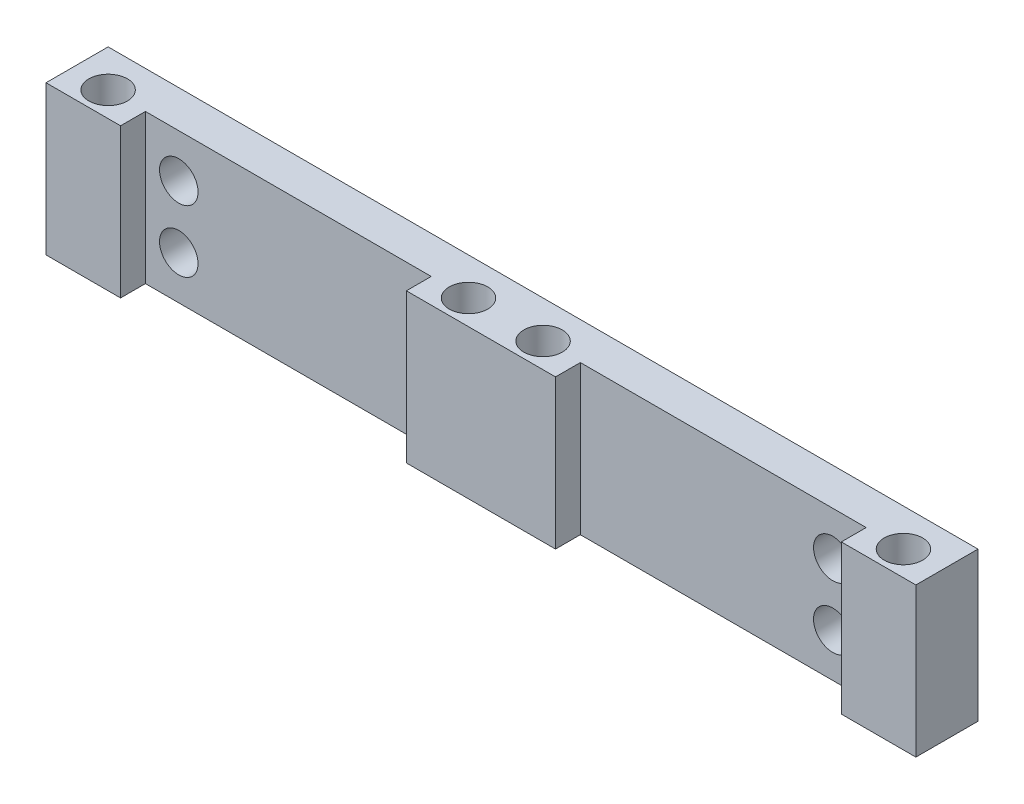
from build123d import *

# Parameters (mm, degrees)
SKETCH_1_W                = 100
SKETCH_1_H                = 12
SKETCH_1_R                = 1.75
EXTRUDE_1_DEPTH           = 5
EXTRUDE_2_DEPTH           = 3
EXTRUDE_5_DEPTH           = 35
CUT_EXTRUDE_START         = -7
CUT_EXTRUDE_3_OUTLINE_R   = 1.75
CUT_EXTRUDE_3_DEPTH       = 14
SKETCH_19_W               = 65
SKETCH_19_H               = 12
CUT_EXTRUDE_7_DEPTH       = 10
CUT_EXTRUDE_8_DEPTH       = 10
SKETCH_21_R               = 1.75
CUT_EXTRUDE_9_DEPTH       = 25
FILLET_3_R                = 2
FILLET_4_R                = 1
FILLET_5_R                = 5
CUT_EXTRUDE_10_DEPTH      = 10
CUT_EXTRUDE_10_DEPTH_BACK = 20
SKETCH_22_W               = 69.035693394
SKETCH_22_H               = 99.85453556
SKETCH_24_W               = 23
SKETCH_24_H               = 12
CUT_EXTRUDE_11_DEPTH      = 2
SKETCH_25_R               = 1.55
CUT_EXTRUDE_12_DEPTH      = 17
SKETCH_27_R               = 1.75
EXTRUDE_7_DEPTH           = 3
SKETCH_28_R               = 1.55
CUT_EXTRUDE_13_DEPTH      = 11


# Read off the part's stored shape, not the designer's step: 切除-拉伸3
with BuildPart() as part:
    # 草图1 → 凸台-拉伸1 (new body)
    with BuildSketch(Plane.XY):
        Rectangle(SKETCH_1_W, SKETCH_1_H)
        with Locations((-26.315, 2.5)):
            Circle(SKETCH_1_R, mode=Mode.SUBTRACT)
        with Locations((-26.315, -2.5)):
            Circle(SKETCH_1_R, mode=Mode.SUBTRACT)
        with Locations((26.315, -2.5)):
            Circle(SKETCH_1_R, mode=Mode.SUBTRACT)
        with Locations((26.315, 2.5)):
            Circle(SKETCH_1_R, mode=Mode.SUBTRACT)
    extrude(amount=-EXTRUDE_1_DEPTH)

    # 草图2 → 凸台-拉伸2 (add)
    with BuildSketch(Plane(origin=(15, 0, 0), x_dir=(0, 0, -1), z_dir=(1, 0, 0))):
        Polygon((0, 6), (-92, 7), (-92, -7), (0, -6), align=None)
    extrude(amount=EXTRUDE_2_DEPTH)

    # 草图10 → 凸台-拉伸5 (add)
    with BuildSketch(Plane(origin=(18, 0, 0), x_dir=(0, 0, -1), z_dir=(1, 0, 0))):
        Polygon((-92, -3.999822784), (-92, -7), (0, -6), (0, -2.999822784), align=None)
        Polygon((-92, 7), (-92, 3.999822784), (0, 2.999822784), (0, 6), align=None)
    extrude(amount=EXTRUDE_5_DEPTH)

    # 切除-拉伸3 outline → 切除-拉伸3 (cut)
    with BuildSketch(Plane(origin=(0, 0, 0), x_dir=(1, 0, 0), z_dir=(0, 1, 0)).offset(CUT_EXTRUDE_START)):
        Polygon((29.145728922, -84.958399081), (31.382950186, -83.842674644), (15, -50.992014289), (15, -92), (32.657445151, -92), align=None)
        Polygon((42.101361871, -11.45542087), (17.526825547, -47.095951771), (33.361948293, -78.848122968), align=None)
        Polygon((40.711441699, -87.983392029), (32.657445151, -92), (53, -92), (53, 0), (50, 0), (44.585265539, -7.853007208), (34.962504207, -82.057515546), (37.199725471, -80.941791109), align=None)
        with Locations((19, -37.702345436)):
            Circle(CUT_EXTRUDE_3_OUTLINE_R)
        with BuildLine():
            Line((22.646536548, -32.624253352), (45.141316474, 0))
            Line((45.141316474, 0), (19, 0))
            Line((19, 0), (19, -31.488948372))
            ThreePointArc((19, -31.488948372), (20.405472076, -33.398539047), (22.646536548, -32.624253352))
        make_face()
    extrude(amount=CUT_EXTRUDE_3_DEPTH, mode=Mode.SUBTRACT)

    # 草图19 → 切除-拉伸7 (cut)
    with BuildSketch(Plane.XY):
        with Locations((-17.5, 0)):
            Rectangle(SKETCH_19_W, SKETCH_19_H)
    extrude(amount=-CUT_EXTRUDE_7_DEPTH, mode=Mode.SUBTRACT)

    # 草图20 → 切除-拉伸8 (cut)
    with BuildSketch(Plane.ZY.offset(-15)):
        Polygon((0, 2.999822784), (0, -2.999822784), (59.734349104, -3.649109187), (59.734349104, 3.649109187), align=None)
    extrude(amount=-CUT_EXTRUDE_8_DEPTH, mode=Mode.SUBTRACT)

    # 草图21 → 切除-拉伸9 (cut, symmetric)
    with BuildSketch(Plane(origin=(0, 0, 0.28540368), x_dir=(1, 0, 0), z_dir=(0, -1, 0))):
        with Locations(Location((35, 86.328690729, 0), (0, 0, 270))):
            Circle(SKETCH_21_R)
    extrude(amount=CUT_EXTRUDE_9_DEPTH, both=True, mode=Mode.SUBTRACT)

    # 圆角3
    # the kernel refuses this fillet: 2 mm, written as the material it adds along each edge
    with BuildSketch(Plane(origin=(31.382950186, -1.088843796, 83.842674644), x_dir=(-0.4462897746148819, 0, -0.8948885053872343), z_dir=(0, 1, 0))) as fillet_3_piece_1_section:
        with BuildLine():
            CenterArc((FILLET_3_R, FILLET_3_R), FILLET_3_R, 180.000000004, 89.999999996)
            Line((-FILLET_3_R * 7.06970432153e-11, FILLET_3_R), (-FILLET_3_R * 0.0200000000707, FILLET_3_R))
            Line((-FILLET_3_R * 0.0200000000707, FILLET_3_R), (-FILLET_3_R * 0.0199999999986, -FILLET_3_R * 0.02))
            Line((-FILLET_3_R * 0.0199999999986, -FILLET_3_R * 0.02), (FILLET_3_R, -FILLET_3_R * 0.02))
            Line((FILLET_3_R, -FILLET_3_R * 0.02), (FILLET_3_R, 0))
        make_face()
    fillet_3_piece_1 = extrude(amount=13.000177215, mode=Mode.PRIVATE)
    fillet_3_piece_1 = split(fillet_3_piece_1, bisect_by=Plane(origin=(30.775677766, 3.909125577, 83.655856907), z_dir=(0, 0.9999409315100345, -0.01086892316858714)), keep=Keep.TOP, mode=Mode.PRIVATE)
    fillet_3_piece_1 = split(fillet_3_piece_1, bisect_by=Plane(origin=(30.775677766, 6.908948371, 83.623250137), z_dir=(0, -0.9999409315100345, 0.010868923168587275)), keep=Keep.TOP, mode=Mode.PRIVATE)
    add(fillet_3_piece_1)
    with BuildSketch(Plane(origin=(31.382950186, -11.91133342, 83.842674644), x_dir=(-0.8948885053556793, 0, 0.44628977467815495), z_dir=(0, 1, 0))) as fillet_3_piece_2_section:
        with BuildLine():
            CenterArc((FILLET_3_R, -FILLET_3_R), FILLET_3_R, 90, 89.999999996)
            Line((-FILLET_3_R * 7.0703401566e-11, -FILLET_3_R), (-FILLET_3_R * 0.0200000000707, -FILLET_3_R))
            Line((-FILLET_3_R * 0.0200000000707, -FILLET_3_R), (-FILLET_3_R * 0.0199999999986, FILLET_3_R * 0.02))
            Line((-FILLET_3_R * 0.0199999999986, FILLET_3_R * 0.02), (FILLET_3_R, FILLET_3_R * 0.02))
            Line((FILLET_3_R, FILLET_3_R * 0.02), (FILLET_3_R, 0))
        make_face()
    fillet_3_piece_2 = extrude(amount=13.000177215, mode=Mode.PRIVATE)
    fillet_3_piece_2 = split(fillet_3_piece_2, bisect_by=Plane(origin=(30.775677766, -6.908948371, 83.623250137), z_dir=(0, 0.9999409315100345, 0.01086892316858739)), keep=Keep.TOP, mode=Mode.PRIVATE)
    fillet_3_piece_2 = split(fillet_3_piece_2, bisect_by=Plane(origin=(30.775677766, -3.909125577, 83.655856907), z_dir=(0, -0.9999409315100345, -0.010868923168587516)), keep=Keep.TOP, mode=Mode.PRIVATE)
    add(fillet_3_piece_2)
    with BuildSketch(Plane(origin=(17.526825547, -9.462581156, 47.095951771), x_dir=(0.4462897746085541, 0, 0.8948885053903899), z_dir=(0, 1, 0))) as fillet_3_piece_3_section:
        with BuildLine():
            CenterArc((FILLET_3_R * 0.590133727356, FILLET_3_R), FILLET_3_R, 208.907423837, 61.092576163)
            Line((-FILLET_3_R * 0.285268173202, FILLET_3_R * 0.516604186511), (-FILLET_3_R * 0.302776211214, FILLET_3_R * 0.506936270242))
            Line((-FILLET_3_R * 0.302776211214, FILLET_3_R * 0.506936270242), (-FILLET_3_R * 0.0118026745471, -FILLET_3_R * 0.02))
            Line((-FILLET_3_R * 0.0118026745471, -FILLET_3_R * 0.02), (FILLET_3_R * 0.590133727356, -FILLET_3_R * 0.02))
            Line((FILLET_3_R * 0.590133727356, -FILLET_3_R * 0.02), (FILLET_3_R * 0.590133727356, 0))
        make_face()
    fillet_3_piece_3 = extrude(amount=8.90151449, mode=Mode.PRIVATE)
    fillet_3_piece_3 = split(fillet_3_piece_3, bisect_by=Plane(origin=(17.786448955, -6.511934641, 47.097986993), z_dir=(0, 0.9999409315100345, 0.01086892316858739)), keep=Keep.TOP, mode=Mode.PRIVATE)
    fillet_3_piece_3 = split(fillet_3_piece_3, bisect_by=Plane(origin=(17.786448955, -3.512111847, 47.130593763), z_dir=(0, -0.9999409315100345, -0.010868923168587516)), keep=Keep.TOP, mode=Mode.PRIVATE)
    add(fillet_3_piece_3)
    with BuildSketch(Plane(origin=(34.962504207, -4.590143726, 82.057515546), x_dir=(0.8948885053556189, 0, -0.44628977467827596), z_dir=(0, 1, 0))) as fillet_3_piece_4_section:
        with BuildLine():
            CenterArc((3.552161927, 1.700868978), FILLET_3_R, 146.105291032, 92.153667276)
            Line((1.892034353, 2.816205895), (1.858831801, 2.838512633))
            Line((1.858831801, 2.838512633), (-0.033202551, 0.022306738))
            Line((-0.033202551, 0.022306738), (0, -0.04))
            ThreePointArc((0, -0.04), (1.25, -0.04), (2.478956762, -0.03401738))
            Line((2.478956762, -0.03401738), (2.500000001, 0))
        make_face()
    fillet_3_piece_4 = extrude(amount=19.96396927, mode=Mode.PRIVATE)
    fillet_3_piece_4 = split(fillet_3_piece_4, bisect_by=Plane(origin=(35.702859812, -3.878883458, 80.873581964), z_dir=(0, -0.9999409315100345, -0.010868923168587516)), keep=Keep.TOP, mode=Mode.PRIVATE)
    add(fillet_3_piece_4)
    with BuildSketch(Plane(origin=(34.962504207, -4.590143726, 82.057515546), x_dir=(0.8948885053556189, 0, -0.44628977467827596), z_dir=(0, 1, 0))) as fillet_3_piece_5_section:
        with BuildLine():
            CenterArc((3.552161927, 1.700868978), FILLET_3_R, 146.105291032, 92.153667276)
            Line((1.892034353, 2.816205895), (1.858831801, 2.838512633))
            Line((1.858831801, 2.838512633), (-0.033202551, 0.022306738))
            Line((-0.033202551, 0.022306738), (0, -0.04))
            ThreePointArc((0, -0.04), (1.25, -0.04), (2.478956762, -0.03401738))
            Line((2.478956762, -0.03401738), (2.500000001, 0))
        make_face()
    fillet_3_piece_5 = extrude(amount=19.96396927, mode=Mode.PRIVATE)
    fillet_3_piece_5 = split(fillet_3_piece_5, bisect_by=Plane(origin=(35.703261473, 3.879081131, 80.891767963), z_dir=(0, 0.9999409315100345, -0.01086892316858714)), keep=Keep.TOP, mode=Mode.PRIVATE)
    fillet_3_piece_5 = split(fillet_3_piece_5, bisect_by=Plane(origin=(35.703261473, 6.878903926, 80.859161193), z_dir=(0, -0.9999409315100345, 0.010868923168587275)), keep=Keep.TOP, mode=Mode.PRIVATE)
    add(fillet_3_piece_5)
    with BuildSketch(Plane(origin=(34.962504207, -15.373825544, 82.057515546), x_dir=(0.8948885053556189, 0, -0.44628977467827596), z_dir=(0, 1, 0))) as fillet_3_piece_6_section:
        with BuildLine():
            CenterArc((3.552161927, 1.700868978), FILLET_3_R, 146.105291032, 92.153667276)
            Line((1.892034353, 2.816205895), (1.858831801, 2.838512633))
            Line((1.858831801, 2.838512633), (-0.033202551, 0.022306738))
            Line((-0.033202551, 0.022306738), (0, -0.04))
            ThreePointArc((0, -0.04), (1.25, -0.04), (2.478956762, -0.03401738))
            Line((2.478956762, -0.03401738), (2.500000001, 0))
        make_face()
    fillet_3_piece_6 = extrude(amount=19.96396927, mode=Mode.PRIVATE)
    fillet_3_piece_6 = split(fillet_3_piece_6, bisect_by=Plane(origin=(35.703261473, -6.878903926, 80.859161193), z_dir=(0, 0.9999409315100345, 0.01086892316858739)), keep=Keep.TOP, mode=Mode.PRIVATE)
    fillet_3_piece_6 = split(fillet_3_piece_6, bisect_by=Plane(origin=(35.703261473, -3.879081131, 80.891767963), z_dir=(0, -0.9999409315100345, -0.010868923168587516)), keep=Keep.TOP, mode=Mode.PRIVATE)
    add(fillet_3_piece_6)
    with BuildSketch(Plane(origin=(34.962504207, -15.373825544, 82.057515546), x_dir=(0.8948885053556189, 0, -0.44628977467827596), z_dir=(0, 1, 0))) as fillet_3_piece_7_section:
        with BuildLine():
            CenterArc((3.552161927, 1.700868978), FILLET_3_R, 146.105291032, 92.153667276)
            Line((1.892034353, 2.816205895), (1.858831801, 2.838512633))
            Line((1.858831801, 2.838512633), (-0.033202551, 0.022306738))
            Line((-0.033202551, 0.022306738), (0, -0.04))
            ThreePointArc((0, -0.04), (1.25, -0.04), (2.478956762, -0.03401738))
            Line((2.478956762, -0.03401738), (2.500000001, 0))
        make_face()
    fillet_3_piece_7 = extrude(amount=19.96396927, mode=Mode.PRIVATE)
    fillet_3_piece_7 = split(fillet_3_piece_7, bisect_by=Plane(origin=(35.702859812, 3.878883458, 80.873581964), z_dir=(0, 0.9999409315100345, -0.01086892316858714)), keep=Keep.TOP, mode=Mode.PRIVATE)
    add(fillet_3_piece_7)
    with BuildSketch(Plane(origin=(17.526825547, 0.561066667, 47.095951771), x_dir=(0.4462897746085541, 0, 0.8948885053903899), z_dir=(0, 1, 0))) as fillet_3_piece_8_section:
        with BuildLine():
            CenterArc((FILLET_3_R * 0.590133727356, FILLET_3_R), FILLET_3_R, 208.907423837, 61.092576163)
            Line((-FILLET_3_R * 0.285268173202, FILLET_3_R * 0.516604186511), (-FILLET_3_R * 0.302776211214, FILLET_3_R * 0.506936270242))
            Line((-FILLET_3_R * 0.302776211214, FILLET_3_R * 0.506936270242), (-FILLET_3_R * 0.0118026745471, -FILLET_3_R * 0.02))
            Line((-FILLET_3_R * 0.0118026745471, -FILLET_3_R * 0.02), (FILLET_3_R * 0.590133727356, -FILLET_3_R * 0.02))
            Line((FILLET_3_R * 0.590133727356, -FILLET_3_R * 0.02), (FILLET_3_R * 0.590133727356, 0))
        make_face()
    fillet_3_piece_8 = extrude(amount=8.90151449, mode=Mode.PRIVATE)
    fillet_3_piece_8 = split(fillet_3_piece_8, bisect_by=Plane(origin=(17.786448955, 3.512111847, 47.130593763), z_dir=(0, 0.9999409315100345, -0.01086892316858714)), keep=Keep.TOP, mode=Mode.PRIVATE)
    fillet_3_piece_8 = split(fillet_3_piece_8, bisect_by=Plane(origin=(17.786448955, 6.511934641, 47.097986993), z_dir=(0, -0.9999409315100345, 0.010868923168587275)), keep=Keep.TOP, mode=Mode.PRIVATE)
    add(fillet_3_piece_8)
    with BuildSketch(Plane(origin=(19, -11, 0), x_dir=(1, 0, 0), z_dir=(0, 1, 0))) as fillet_3_piece_9_section:
        with BuildLine():
            CenterArc((FILLET_3_R, -FILLET_3_R), FILLET_3_R, 90, 90)
            Line((0, -FILLET_3_R), (-FILLET_3_R * 0.02, -FILLET_3_R))
            Line((-FILLET_3_R * 0.02, -FILLET_3_R), (-FILLET_3_R * 0.02, FILLET_3_R * 0.02))
            Line((-FILLET_3_R * 0.02, FILLET_3_R * 0.02), (FILLET_3_R, FILLET_3_R * 0.02))
            Line((FILLET_3_R, FILLET_3_R * 0.02), (FILLET_3_R, 0))
        make_face()
    fillet_3_piece_9 = extrude(amount=13.000177216, mode=Mode.PRIVATE)
    fillet_3_piece_9 = split(fillet_3_piece_9, bisect_by=Plane(origin=(19.212945359, -6, 0.86023594), z_dir=(0, -1, 0)), keep=Keep.TOP, mode=Mode.PRIVATE)
    fillet_3_piece_9 = split(fillet_3_piece_9, bisect_by=Plane(origin=(19.212945359, -6.009349838, 0.860185129), z_dir=(0, 0.9999409315100345, 0.01086892316858739)), keep=Keep.TOP, mode=Mode.PRIVATE)
    add(fillet_3_piece_9)
    with BuildSketch(Plane(origin=(19, -6, 0), x_dir=(1, 0, 0), z_dir=(0, 1, 0))) as fillet_3_piece_10_section:
        with BuildLine():
            CenterArc((FILLET_3_R, -FILLET_3_R), FILLET_3_R, 90, 90)
            Line((0, -FILLET_3_R), (-FILLET_3_R * 0.02, -FILLET_3_R))
            Line((-FILLET_3_R * 0.02, -FILLET_3_R), (-FILLET_3_R * 0.02, FILLET_3_R * 0.02))
            Line((-FILLET_3_R * 0.02, FILLET_3_R * 0.02), (FILLET_3_R, FILLET_3_R * 0.02))
            Line((FILLET_3_R, FILLET_3_R * 0.02), (FILLET_3_R, 0))
        make_face()
    fillet_3_piece_10 = extrude(amount=8.000177216, mode=Mode.PRIVATE)
    fillet_3_piece_10 = split(fillet_3_piece_10, bisect_by=Plane(origin=(19.453185723, -3.004914034, 0.468394952), z_dir=(0, -0.9999409315100345, -0.010868923168587516)), keep=Keep.TOP, mode=Mode.PRIVATE)
    add(fillet_3_piece_10)
    with BuildSketch(Plane(origin=(19, -6, 0), x_dir=(1, 0, 0), z_dir=(0, 1, 0))) as fillet_3_piece_11_section:
        with BuildLine():
            CenterArc((FILLET_3_R, -FILLET_3_R), FILLET_3_R, 90, 90)
            Line((0, -FILLET_3_R), (-FILLET_3_R * 0.02, -FILLET_3_R))
            Line((-FILLET_3_R * 0.02, -FILLET_3_R), (-FILLET_3_R * 0.02, FILLET_3_R * 0.02))
            Line((-FILLET_3_R * 0.02, FILLET_3_R * 0.02), (FILLET_3_R, FILLET_3_R * 0.02))
            Line((FILLET_3_R, FILLET_3_R * 0.02), (FILLET_3_R, 0))
        make_face()
    fillet_3_piece_11 = extrude(amount=8.000177216, mode=Mode.PRIVATE)
    fillet_3_piece_11 = split(fillet_3_piece_11, bisect_by=Plane(origin=(19.98, -5.999710162, -0.026665092), z_dir=(0, -0.9999409315100345, -0.01086892316858739)), keep=Keep.TOP, mode=Mode.PRIVATE)
    add(fillet_3_piece_11)
    with BuildSketch(Plane(origin=(19, -2.000177216, 0), x_dir=(1, 0, 0), z_dir=(0, 1, 0))) as fillet_3_piece_12_section:
        with BuildLine():
            CenterArc((FILLET_3_R, -FILLET_3_R), FILLET_3_R, 90, 90)
            Line((0, -FILLET_3_R), (-FILLET_3_R * 0.02, -FILLET_3_R))
            Line((-FILLET_3_R * 0.02, -FILLET_3_R), (-FILLET_3_R * 0.02, FILLET_3_R * 0.02))
            Line((-FILLET_3_R * 0.02, FILLET_3_R * 0.02), (FILLET_3_R, FILLET_3_R * 0.02))
            Line((FILLET_3_R, FILLET_3_R * 0.02), (FILLET_3_R, 0))
        make_face()
    fillet_3_piece_12 = extrude(amount=8.000177216, mode=Mode.PRIVATE)
    fillet_3_piece_12 = split(fillet_3_piece_12, bisect_by=Plane(origin=(19.453185723, 3.004914034, 0.468394952), z_dir=(0, 0.9999409315100345, -0.01086892316858714)), keep=Keep.TOP, mode=Mode.PRIVATE)
    add(fillet_3_piece_12)
    with BuildSketch(Plane(origin=(19, -2.000177216, 0), x_dir=(1, 0, 0), z_dir=(0, 1, 0))) as fillet_3_piece_13_section:
        with BuildLine():
            CenterArc((FILLET_3_R, -FILLET_3_R), FILLET_3_R, 90, 90)
            Line((0, -FILLET_3_R), (-FILLET_3_R * 0.02, -FILLET_3_R))
            Line((-FILLET_3_R * 0.02, -FILLET_3_R), (-FILLET_3_R * 0.02, FILLET_3_R * 0.02))
            Line((-FILLET_3_R * 0.02, FILLET_3_R * 0.02), (FILLET_3_R, FILLET_3_R * 0.02))
            Line((FILLET_3_R, FILLET_3_R * 0.02), (FILLET_3_R, 0))
        make_face()
    fillet_3_piece_13 = extrude(amount=13.000177216, mode=Mode.PRIVATE)
    fillet_3_piece_13 = split(fillet_3_piece_13, bisect_by=Plane(origin=(19.212945359, 6, 0.86023594), z_dir=(0, 1, 0)), keep=Keep.TOP, mode=Mode.PRIVATE)
    fillet_3_piece_13 = split(fillet_3_piece_13, bisect_by=Plane(origin=(19.212945359, 6.009349838, 0.860185129), z_dir=(0, -0.9999409315100345, 0.010868923168587275)), keep=Keep.TOP, mode=Mode.PRIVATE)
    add(fillet_3_piece_13)
    with BuildSketch(Plane(origin=(19, -2.000177216, 0), x_dir=(1, 0, 0), z_dir=(0, 1, 0))) as fillet_3_piece_14_section:
        with BuildLine():
            CenterArc((FILLET_3_R, -FILLET_3_R), FILLET_3_R, 90, 90)
            Line((0, -FILLET_3_R), (-FILLET_3_R * 0.02, -FILLET_3_R))
            Line((-FILLET_3_R * 0.02, -FILLET_3_R), (-FILLET_3_R * 0.02, FILLET_3_R * 0.02))
            Line((-FILLET_3_R * 0.02, FILLET_3_R * 0.02), (FILLET_3_R, FILLET_3_R * 0.02))
            Line((FILLET_3_R, FILLET_3_R * 0.02), (FILLET_3_R, 0))
        make_face()
    fillet_3_piece_14 = extrude(amount=8.000177216, mode=Mode.PRIVATE)
    fillet_3_piece_14 = split(fillet_3_piece_14, bisect_by=Plane(origin=(19.98, 5.999710162, -0.026665092), z_dir=(0, 0.9999409315100345, -0.010868923168587275)), keep=Keep.TOP, mode=Mode.PRIVATE)
    add(fillet_3_piece_14)
    with BuildSketch(Plane(origin=(45.141316474, -6.521086374, 0), x_dir=(-1, 0, 0), z_dir=(0, 1, 0))) as fillet_3_piece_15_section:
        with BuildLine():
            CenterArc((FILLET_3_R * 1.90418183162, FILLET_3_R), FILLET_3_R, 145.413311576, 124.586688424)
            Line((FILLET_3_R * 1.08091355769, FILLET_3_R * 1.56765248977), (FILLET_3_R * 1.06444819221, FILLET_3_R * 1.57900553956))
            Line((FILLET_3_R * 1.06444819221, FILLET_3_R * 1.57900553956), (-FILLET_3_R * 0.0164653654786, FILLET_3_R * 0.0113530497954))
            Line((-FILLET_3_R * 0.0164653654786, FILLET_3_R * 0.0113530497954), (0, -FILLET_3_R * 0.02))
            Line((0, -FILLET_3_R * 0.02), (FILLET_3_R * 1.90418183162, -FILLET_3_R * 0.02))
            Line((FILLET_3_R * 1.90418183162, -FILLET_3_R * 0.02), (FILLET_3_R * 1.90418183162, 0))
        make_face()
    fillet_3_piece_15 = extrude(amount=12.521086374, mode=Mode.PRIVATE)
    fillet_3_piece_15 = split(fillet_3_piece_15, bisect_by=Plane(origin=(43.662831951, -6, 1.349647934), z_dir=(0, -1, 0)), keep=Keep.TOP, mode=Mode.PRIVATE)
    fillet_3_piece_15 = split(fillet_3_piece_15, bisect_by=Plane(origin=(43.662831951, -6.01466922, 1.349568214), z_dir=(0, 0.9999409315100345, 0.01086892316858739)), keep=Keep.TOP, mode=Mode.PRIVATE)
    add(fillet_3_piece_15)
    with BuildSketch(Plane(origin=(45.141316474, -6.521086374, 0), x_dir=(-1, 0, 0), z_dir=(0, 1, 0))) as fillet_3_piece_16_section:
        with BuildLine():
            CenterArc((FILLET_3_R * 1.90418183162, FILLET_3_R), FILLET_3_R, 145.413311576, 124.586688424)
            Line((FILLET_3_R * 1.08091355769, FILLET_3_R * 1.56765248977), (FILLET_3_R * 1.06444819221, FILLET_3_R * 1.57900553956))
            Line((FILLET_3_R * 1.06444819221, FILLET_3_R * 1.57900553956), (-FILLET_3_R * 0.0164653654786, FILLET_3_R * 0.0113530497954))
            Line((-FILLET_3_R * 0.0164653654786, FILLET_3_R * 0.0113530497954), (0, -FILLET_3_R * 0.02))
            Line((0, -FILLET_3_R * 0.02), (FILLET_3_R * 1.90418183162, -FILLET_3_R * 0.02))
            Line((FILLET_3_R * 1.90418183162, -FILLET_3_R * 0.02), (FILLET_3_R * 1.90418183162, 0))
        make_face()
    fillet_3_piece_16 = extrude(amount=12.521086374, mode=Mode.PRIVATE)
    fillet_3_piece_16 = split(fillet_3_piece_16, bisect_by=Plane(origin=(43.652851134, -6, 0.780052661), z_dir=(0, 1, 0)), keep=Keep.TOP, mode=Mode.PRIVATE)
    fillet_3_piece_16 = split(fillet_3_piece_16, bisect_by=Plane(origin=(43.652851134, -3.008478327, 0.79630992), z_dir=(0, -0.9999409315100345, -0.010868923168587516)), keep=Keep.TOP, mode=Mode.PRIVATE)
    add(fillet_3_piece_16)
    with BuildSketch(Plane(origin=(45.141316474, -6.521086374, 0), x_dir=(-1, 0, 0), z_dir=(0, 1, 0))) as fillet_3_piece_17_section:
        with BuildLine():
            CenterArc((FILLET_3_R * 1.90418183162, FILLET_3_R), FILLET_3_R, 145.413311576, 124.586688424)
            Line((FILLET_3_R * 1.08091355769, FILLET_3_R * 1.56765248977), (FILLET_3_R * 1.06444819221, FILLET_3_R * 1.57900553956))
            Line((FILLET_3_R * 1.06444819221, FILLET_3_R * 1.57900553956), (-FILLET_3_R * 0.0164653654786, FILLET_3_R * 0.0113530497954))
            Line((-FILLET_3_R * 0.0164653654786, FILLET_3_R * 0.0113530497954), (0, -FILLET_3_R * 0.02))
            Line((0, -FILLET_3_R * 0.02), (FILLET_3_R * 1.90418183162, -FILLET_3_R * 0.02))
            Line((FILLET_3_R * 1.90418183162, -FILLET_3_R * 0.02), (FILLET_3_R * 1.90418183162, 0))
        make_face()
    fillet_3_piece_17 = extrude(amount=12.521086374, mode=Mode.PRIVATE)
    fillet_3_piece_17 = split(fillet_3_piece_17, bisect_by=Plane(origin=(43.240638921, -6, -0.026654432), z_dir=(0, 1, 0)), keep=Keep.TOP, mode=Mode.PRIVATE)
    fillet_3_piece_17 = split(fillet_3_piece_17, bisect_by=Plane(origin=(43.240638921, -5.999710295, -0.026652857), z_dir=(0, -0.9999409315100345, -0.01086892316858739)), keep=Keep.TOP, mode=Mode.PRIVATE)
    add(fillet_3_piece_17)
    with BuildSketch(Plane(origin=(45.141316474, -6.521086374, 0), x_dir=(-1, 0, 0), z_dir=(0, 1, 0))) as fillet_3_piece_18_section:
        with BuildLine():
            CenterArc((FILLET_3_R * 1.90418183162, FILLET_3_R), FILLET_3_R, 145.413311576, 124.586688424)
            Line((FILLET_3_R * 1.08091355769, FILLET_3_R * 1.56765248977), (FILLET_3_R * 1.06444819221, FILLET_3_R * 1.57900553956))
            Line((FILLET_3_R * 1.06444819221, FILLET_3_R * 1.57900553956), (-FILLET_3_R * 0.0164653654786, FILLET_3_R * 0.0113530497954))
            Line((-FILLET_3_R * 0.0164653654786, FILLET_3_R * 0.0113530497954), (0, -FILLET_3_R * 0.02))
            Line((0, -FILLET_3_R * 0.02), (FILLET_3_R * 1.90418183162, -FILLET_3_R * 0.02))
            Line((FILLET_3_R * 1.90418183162, -FILLET_3_R * 0.02), (FILLET_3_R * 1.90418183162, 0))
        make_face()
    fillet_3_piece_18 = extrude(amount=12.521086374, mode=Mode.PRIVATE)
    fillet_3_piece_18 = split(fillet_3_piece_18, bisect_by=Plane(origin=(43.652851134, 3.008478327, 0.79630992), z_dir=(0, 0.9999409315100345, -0.01086892316858714)), keep=Keep.TOP, mode=Mode.PRIVATE)
    add(fillet_3_piece_18)
    with BuildSketch(Plane(origin=(45.141316474, -6.521086374, 0), x_dir=(-1, 0, 0), z_dir=(0, 1, 0))) as fillet_3_piece_19_section:
        with BuildLine():
            CenterArc((FILLET_3_R * 1.90418183162, FILLET_3_R), FILLET_3_R, 145.413311576, 124.586688424)
            Line((FILLET_3_R * 1.08091355769, FILLET_3_R * 1.56765248977), (FILLET_3_R * 1.06444819221, FILLET_3_R * 1.57900553956))
            Line((FILLET_3_R * 1.06444819221, FILLET_3_R * 1.57900553956), (-FILLET_3_R * 0.0164653654786, FILLET_3_R * 0.0113530497954))
            Line((-FILLET_3_R * 0.0164653654786, FILLET_3_R * 0.0113530497954), (0, -FILLET_3_R * 0.02))
            Line((0, -FILLET_3_R * 0.02), (FILLET_3_R * 1.90418183162, -FILLET_3_R * 0.02))
            Line((FILLET_3_R * 1.90418183162, -FILLET_3_R * 0.02), (FILLET_3_R * 1.90418183162, 0))
        make_face()
    fillet_3_piece_19 = extrude(amount=22.041995532, mode=Mode.PRIVATE)
    fillet_3_piece_19 = split(fillet_3_piece_19, bisect_by=Plane(origin=(43.662831951, 6, 1.349647934), z_dir=(0, 1, 0)), keep=Keep.TOP, mode=Mode.PRIVATE)
    fillet_3_piece_19 = split(fillet_3_piece_19, bisect_by=Plane(origin=(43.662831951, 6.01466922, 1.349568214), z_dir=(0, -0.9999409315100345, 0.010868923168587275)), keep=Keep.TOP, mode=Mode.PRIVATE)
    add(fillet_3_piece_19)
    with BuildSketch(Plane(origin=(45.141316474, -6.521086374, 0), x_dir=(-1, 0, 0), z_dir=(0, 1, 0))) as fillet_3_piece_20_section:
        with BuildLine():
            CenterArc((FILLET_3_R * 1.90418183162, FILLET_3_R), FILLET_3_R, 145.413311576, 124.586688424)
            Line((FILLET_3_R * 1.08091355769, FILLET_3_R * 1.56765248977), (FILLET_3_R * 1.06444819221, FILLET_3_R * 1.57900553956))
            Line((FILLET_3_R * 1.06444819221, FILLET_3_R * 1.57900553956), (-FILLET_3_R * 0.0164653654786, FILLET_3_R * 0.0113530497954))
            Line((-FILLET_3_R * 0.0164653654786, FILLET_3_R * 0.0113530497954), (0, -FILLET_3_R * 0.02))
            Line((0, -FILLET_3_R * 0.02), (FILLET_3_R * 1.90418183162, -FILLET_3_R * 0.02))
            Line((FILLET_3_R * 1.90418183162, -FILLET_3_R * 0.02), (FILLET_3_R * 1.90418183162, 0))
        make_face()
    fillet_3_piece_20 = extrude(amount=12.521086374, mode=Mode.PRIVATE)
    fillet_3_piece_20 = split(fillet_3_piece_20, bisect_by=Plane(origin=(43.240638921, 5.999710295, -0.026652857), z_dir=(0, 0.9999409315100345, -0.010868923168587275)), keep=Keep.TOP, mode=Mode.PRIVATE)
    add(fillet_3_piece_20)
    with BuildSketch(Plane(origin=(45.141316474, -15.520909158, 0), x_dir=(-1, 0, 0), z_dir=(0, 1, 0))) as fillet_3_piece_21_section:
        with BuildLine():
            CenterArc((FILLET_3_R * 1.90418183162, FILLET_3_R), FILLET_3_R, 145.413311576, 124.586688424)
            Line((FILLET_3_R * 1.08091355769, FILLET_3_R * 1.56765248977), (FILLET_3_R * 1.06444819221, FILLET_3_R * 1.57900553956))
            Line((FILLET_3_R * 1.06444819221, FILLET_3_R * 1.57900553956), (-FILLET_3_R * 0.0164653654786, FILLET_3_R * 0.0113530497954))
            Line((-FILLET_3_R * 0.0164653654786, FILLET_3_R * 0.0113530497954), (0, -FILLET_3_R * 0.02))
            Line((0, -FILLET_3_R * 0.02), (FILLET_3_R * 1.90418183162, -FILLET_3_R * 0.02))
            Line((FILLET_3_R * 1.90418183162, -FILLET_3_R * 0.02), (FILLET_3_R * 1.90418183162, 0))
        make_face()
    fillet_3_piece_21 = extrude(amount=22.041995532, mode=Mode.PRIVATE)
    fillet_3_piece_21 = split(fillet_3_piece_21, bisect_by=Plane(origin=(43.662831951, -6, 1.349647934), z_dir=(0, -1, 0)), keep=Keep.TOP, mode=Mode.PRIVATE)
    fillet_3_piece_21 = split(fillet_3_piece_21, bisect_by=Plane(origin=(43.662831951, -6.01466922, 1.349568214), z_dir=(0, 0.9999409315100345, 0.01086892316858739)), keep=Keep.TOP, mode=Mode.PRIVATE)
    add(fillet_3_piece_21)
    with BuildSketch(Plane(origin=(45.141316474, -6, 0), x_dir=(-1, 0, 0), z_dir=(0, 1, 0))) as fillet_3_piece_22_section:
        with BuildLine():
            CenterArc((FILLET_3_R * 1.90418183162, FILLET_3_R), FILLET_3_R, 145.413311576, 124.586688424)
            Line((FILLET_3_R * 1.08091355769, FILLET_3_R * 1.56765248977), (FILLET_3_R * 1.06444819221, FILLET_3_R * 1.57900553956))
            Line((FILLET_3_R * 1.06444819221, FILLET_3_R * 1.57900553956), (-FILLET_3_R * 0.0164653654786, FILLET_3_R * 0.0113530497954))
            Line((-FILLET_3_R * 0.0164653654786, FILLET_3_R * 0.0113530497954), (0, -FILLET_3_R * 0.02))
            Line((0, -FILLET_3_R * 0.02), (FILLET_3_R * 1.90418183162, -FILLET_3_R * 0.02))
            Line((FILLET_3_R * 1.90418183162, -FILLET_3_R * 0.02), (FILLET_3_R * 1.90418183162, 0))
        make_face()
    fillet_3_piece_22 = extrude(amount=12.521086374, mode=Mode.PRIVATE)
    fillet_3_piece_22 = split(fillet_3_piece_22, bisect_by=Plane(origin=(43.652851134, -3.008478327, 0.79630992), z_dir=(0, -0.9999409315100345, -0.010868923168587516)), keep=Keep.TOP, mode=Mode.PRIVATE)
    add(fillet_3_piece_22)
    with BuildSketch(Plane(origin=(45.141316474, -6, 0), x_dir=(-1, 0, 0), z_dir=(0, 1, 0))) as fillet_3_piece_23_section:
        with BuildLine():
            CenterArc((FILLET_3_R * 1.90418183162, FILLET_3_R), FILLET_3_R, 145.413311576, 124.586688424)
            Line((FILLET_3_R * 1.08091355769, FILLET_3_R * 1.56765248977), (FILLET_3_R * 1.06444819221, FILLET_3_R * 1.57900553956))
            Line((FILLET_3_R * 1.06444819221, FILLET_3_R * 1.57900553956), (-FILLET_3_R * 0.0164653654786, FILLET_3_R * 0.0113530497954))
            Line((-FILLET_3_R * 0.0164653654786, FILLET_3_R * 0.0113530497954), (0, -FILLET_3_R * 0.02))
            Line((0, -FILLET_3_R * 0.02), (FILLET_3_R * 1.90418183162, -FILLET_3_R * 0.02))
            Line((FILLET_3_R * 1.90418183162, -FILLET_3_R * 0.02), (FILLET_3_R * 1.90418183162, 0))
        make_face()
    fillet_3_piece_23 = extrude(amount=12.521086374, mode=Mode.PRIVATE)
    fillet_3_piece_23 = split(fillet_3_piece_23, bisect_by=Plane(origin=(43.240638921, -5.999710295, -0.026652857), z_dir=(0, -0.9999409315100345, -0.01086892316858739)), keep=Keep.TOP, mode=Mode.PRIVATE)
    add(fillet_3_piece_23)
    with BuildSketch(Plane(origin=(45.141316474, -6, 0), x_dir=(-1, 0, 0), z_dir=(0, 1, 0))) as fillet_3_piece_24_section:
        with BuildLine():
            CenterArc((FILLET_3_R * 1.90418183162, FILLET_3_R), FILLET_3_R, 145.413311576, 124.586688424)
            Line((FILLET_3_R * 1.08091355769, FILLET_3_R * 1.56765248977), (FILLET_3_R * 1.06444819221, FILLET_3_R * 1.57900553956))
            Line((FILLET_3_R * 1.06444819221, FILLET_3_R * 1.57900553956), (-FILLET_3_R * 0.0164653654786, FILLET_3_R * 0.0113530497954))
            Line((-FILLET_3_R * 0.0164653654786, FILLET_3_R * 0.0113530497954), (0, -FILLET_3_R * 0.02))
            Line((0, -FILLET_3_R * 0.02), (FILLET_3_R * 1.90418183162, -FILLET_3_R * 0.02))
            Line((FILLET_3_R * 1.90418183162, -FILLET_3_R * 0.02), (FILLET_3_R * 1.90418183162, 0))
        make_face()
    fillet_3_piece_24 = extrude(amount=12.521086374, mode=Mode.PRIVATE)
    fillet_3_piece_24 = split(fillet_3_piece_24, bisect_by=Plane(origin=(43.652851134, 6, 0.780052661), z_dir=(0, -1, 0)), keep=Keep.TOP, mode=Mode.PRIVATE)
    fillet_3_piece_24 = split(fillet_3_piece_24, bisect_by=Plane(origin=(43.652851134, 3.008478327, 0.79630992), z_dir=(0, 0.9999409315100345, -0.01086892316858714)), keep=Keep.TOP, mode=Mode.PRIVATE)
    add(fillet_3_piece_24)
    with BuildSketch(Plane(origin=(45.141316474, -6, 0), x_dir=(-1, 0, 0), z_dir=(0, 1, 0))) as fillet_3_piece_25_section:
        with BuildLine():
            CenterArc((FILLET_3_R * 1.90418183162, FILLET_3_R), FILLET_3_R, 145.413311576, 124.586688424)
            Line((FILLET_3_R * 1.08091355769, FILLET_3_R * 1.56765248977), (FILLET_3_R * 1.06444819221, FILLET_3_R * 1.57900553956))
            Line((FILLET_3_R * 1.06444819221, FILLET_3_R * 1.57900553956), (-FILLET_3_R * 0.0164653654786, FILLET_3_R * 0.0113530497954))
            Line((-FILLET_3_R * 0.0164653654786, FILLET_3_R * 0.0113530497954), (0, -FILLET_3_R * 0.02))
            Line((0, -FILLET_3_R * 0.02), (FILLET_3_R * 1.90418183162, -FILLET_3_R * 0.02))
            Line((FILLET_3_R * 1.90418183162, -FILLET_3_R * 0.02), (FILLET_3_R * 1.90418183162, 0))
        make_face()
    fillet_3_piece_25 = extrude(amount=12.521086374, mode=Mode.PRIVATE)
    fillet_3_piece_25 = split(fillet_3_piece_25, bisect_by=Plane(origin=(43.662831951, 6, 1.349647934), z_dir=(0, 1, 0)), keep=Keep.TOP, mode=Mode.PRIVATE)
    fillet_3_piece_25 = split(fillet_3_piece_25, bisect_by=Plane(origin=(43.662831951, 6.01466922, 1.349568214), z_dir=(0, -0.9999409315100345, 0.010868923168587275)), keep=Keep.TOP, mode=Mode.PRIVATE)
    add(fillet_3_piece_25)
    with BuildSketch(Plane(origin=(45.141316474, -6, 0), x_dir=(-1, 0, 0), z_dir=(0, 1, 0))) as fillet_3_piece_26_section:
        with BuildLine():
            CenterArc((FILLET_3_R * 1.90418183162, FILLET_3_R), FILLET_3_R, 145.413311576, 124.586688424)
            Line((FILLET_3_R * 1.08091355769, FILLET_3_R * 1.56765248977), (FILLET_3_R * 1.06444819221, FILLET_3_R * 1.57900553956))
            Line((FILLET_3_R * 1.06444819221, FILLET_3_R * 1.57900553956), (-FILLET_3_R * 0.0164653654786, FILLET_3_R * 0.0113530497954))
            Line((-FILLET_3_R * 0.0164653654786, FILLET_3_R * 0.0113530497954), (0, -FILLET_3_R * 0.02))
            Line((0, -FILLET_3_R * 0.02), (FILLET_3_R * 1.90418183162, -FILLET_3_R * 0.02))
            Line((FILLET_3_R * 1.90418183162, -FILLET_3_R * 0.02), (FILLET_3_R * 1.90418183162, 0))
        make_face()
    fillet_3_piece_26 = extrude(amount=12.521086374, mode=Mode.PRIVATE)
    fillet_3_piece_26 = split(fillet_3_piece_26, bisect_by=Plane(origin=(43.240638921, 6, -0.026654432), z_dir=(0, -1, 0)), keep=Keep.TOP, mode=Mode.PRIVATE)
    fillet_3_piece_26 = split(fillet_3_piece_26, bisect_by=Plane(origin=(43.240638921, 5.999710295, -0.026652857), z_dir=(0, 0.9999409315100345, -0.010868923168587275)), keep=Keep.TOP, mode=Mode.PRIVATE)
    add(fillet_3_piece_26)

    # 圆角4
    fillet_4_edges = [part.edges().sort_by_distance(p)[0] for p in [
        (42.101361871, 4.624426836, 11.45542087),
        (42.101361871, -4.624426836, 11.45542087),
        (33.361948293, 5.356956207, 78.848122968),
        (33.361948293, -5.356956207, 78.848122968),
    ]]
    fillet(fillet_4_edges, radius=FILLET_4_R)

    # 圆角5
    fillet_5_edges = [part.edges().sort_by_distance(p)[0] for p in [
        (44.585265539, 4.585270166, 7.853007208),
        (44.585265539, -4.585270166, 7.853007208),
    ]]
    fillet(fillet_5_edges, radius=FILLET_5_R)

    # 草图22 → 切除-拉伸10 (cut, two sides: drawn at the far end of the back side and taken through both)
    with BuildSketch(Plane.XZ.offset(6).offset(-CUT_EXTRUDE_10_DEPTH_BACK)):
        with Locations((34.517846697, 49.92726778)):
            Rectangle(SKETCH_22_W, SKETCH_22_H)
    extrude(amount=CUT_EXTRUDE_10_DEPTH + CUT_EXTRUDE_10_DEPTH_BACK, mode=Mode.SUBTRACT)

    # 草图24 → 切除-拉伸11 (cut)
    with BuildSketch(Plane.XY):
        with Locations((32.5, 0)):
            Rectangle(SKETCH_24_W, SKETCH_24_H)
    extrude(amount=-CUT_EXTRUDE_11_DEPTH, mode=Mode.SUBTRACT)

    # 草图25 → 切除-拉伸12 (cut)
    with BuildSketch(Plane(origin=(0, 6, 0), x_dir=(1, 0, 0), z_dir=(0, 1, 0))):
        with Locations(Location((18, 2, 0), (0, 0, 180))):
            Circle(SKETCH_25_R)
        with Locations(Location((47, 2, 0), (0, 0, 180))):
            Circle(SKETCH_25_R)
    extrude(amount=-CUT_EXTRUDE_12_DEPTH, mode=Mode.SUBTRACT)

    # 镜向2: part across plane


with BuildPart() as part_1:
    add(part.part)
    add(part.part.mirror(Plane(origin=(50, -6, -5), x_dir=(0, 0, 1), z_dir=(1, 0, 0))))

    # 草图27 → 凸台-拉伸7 (add)
    with BuildSketch(Plane.XY.offset(-2)):
        with Locations((26.315, 2.5)):
            Circle(SKETCH_27_R)
        with Locations((26.315, -2.5)):
            Circle(SKETCH_27_R)
        with Locations((73.685, 2.5)):
            Circle(SKETCH_27_R)
        with Locations((73.685, -2.5)):
            Circle(SKETCH_27_R)
    extrude(amount=-EXTRUDE_7_DEPTH)

    # 草图28 → 切除-拉伸13 (cut)
    with BuildSketch(Plane.XY.offset(-2)):
        with Locations((23.685, 2.5)):
            Circle(SKETCH_28_R)
        with Locations((23.685, -2.5)):
            Circle(SKETCH_28_R)
        with Locations((76.315, -2.5)):
            Circle(SKETCH_28_R)
        with Locations((76.315, 2.5)):
            Circle(SKETCH_28_R)
    extrude(amount=-CUT_EXTRUDE_13_DEPTH, mode=Mode.SUBTRACT)


solid = part_1.part
